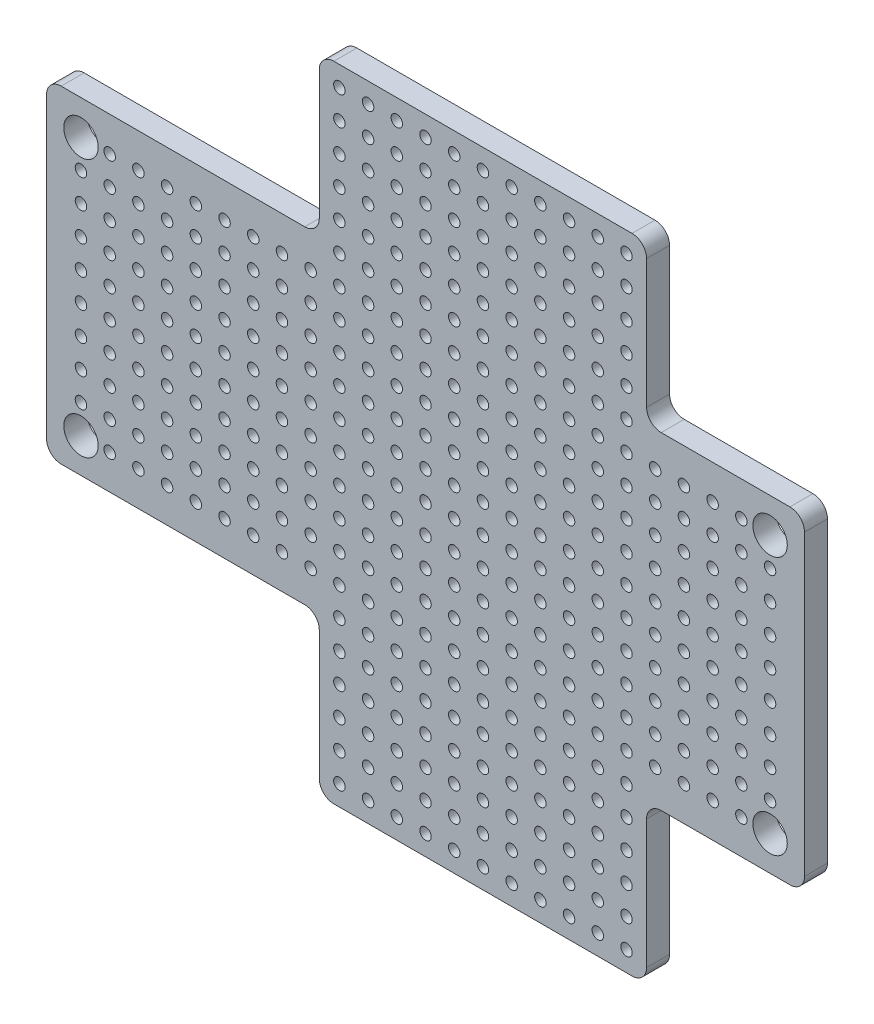
from build123d import *

# Parameters (mm, degrees)
SKETCH1_R           = 1.5
SKETCH1_R_2         = 0.5
BOSS_EXTRUDE1_DEPTH = 2
FILLET1_R           = 1.27


with BuildPart() as part:
    # Sketch1 → Boss-Extrude1 (new body)
    with BuildSketch(Plane.XY):
        Polygon((0, 0), (23.75, 0), (23.75, -13.75), (52.25, -13.75), (52.25, 0), (66, 0), (66, 28.5), (52.25, 28.5), (52.25, 42.25), (23.75, 42.25), (23.75, 28.5), (0, 28.5), align=None)
        with Locations((3, 25.5)):
            Circle(SKETCH1_R, mode=Mode.SUBTRACT)
        with Locations((63, 25.5)):
            Circle(SKETCH1_R, mode=Mode.SUBTRACT)
        with Locations((3, 3)):
            Circle(SKETCH1_R, mode=Mode.SUBTRACT)
        with Locations((63, 3)):
            Circle(SKETCH1_R, mode=Mode.SUBTRACT)
        with Locations((55.5, 5.5)):
            Circle(SKETCH1_R_2, mode=Mode.SUBTRACT)
        with Locations((5.5, 3)):
            Circle(SKETCH1_R_2, mode=Mode.SUBTRACT)
        with Locations((8, 3)):
            Circle(SKETCH1_R_2, mode=Mode.SUBTRACT)
        with Locations((10.5, 3)):
            Circle(SKETCH1_R_2, mode=Mode.SUBTRACT)
        with Locations((13, 3)):
            Circle(SKETCH1_R_2, mode=Mode.SUBTRACT)
        with Locations((15.5, 3)):
            Circle(SKETCH1_R_2, mode=Mode.SUBTRACT)
        with Locations((18, 3)):
            Circle(SKETCH1_R_2, mode=Mode.SUBTRACT)
        with Locations((20.5, 3)):
            Circle(SKETCH1_R_2, mode=Mode.SUBTRACT)
        with Locations((23, 3)):
            Circle(SKETCH1_R_2, mode=Mode.SUBTRACT)
        with Locations((25.5, 3)):
            Circle(SKETCH1_R_2, mode=Mode.SUBTRACT)
        with Locations((28, 3)):
            Circle(SKETCH1_R_2, mode=Mode.SUBTRACT)
        with Locations((30.5, 3)):
            Circle(SKETCH1_R_2, mode=Mode.SUBTRACT)
        with Locations((33, 3)):
            Circle(SKETCH1_R_2, mode=Mode.SUBTRACT)
        with Locations((35.5, 3)):
            Circle(SKETCH1_R_2, mode=Mode.SUBTRACT)
        with Locations((38, 3)):
            Circle(SKETCH1_R_2, mode=Mode.SUBTRACT)
        with Locations((40.5, 3)):
            Circle(SKETCH1_R_2, mode=Mode.SUBTRACT)
        with Locations((43, 3)):
            Circle(SKETCH1_R_2, mode=Mode.SUBTRACT)
        with Locations((45.5, 3)):
            Circle(SKETCH1_R_2, mode=Mode.SUBTRACT)
        with Locations((48, 3)):
            Circle(SKETCH1_R_2, mode=Mode.SUBTRACT)
        with Locations((50.5, 3)):
            Circle(SKETCH1_R_2, mode=Mode.SUBTRACT)
        with Locations((55.5, 10.5)):
            Circle(SKETCH1_R_2, mode=Mode.SUBTRACT)
        with Locations((55.5, 8)):
            Circle(SKETCH1_R_2, mode=Mode.SUBTRACT)
        with Locations((55.5, 15.5)):
            Circle(SKETCH1_R_2, mode=Mode.SUBTRACT)
        with Locations((55.5, 18)):
            Circle(SKETCH1_R_2, mode=Mode.SUBTRACT)
        with Locations((55.5, 20.5)):
            Circle(SKETCH1_R_2, mode=Mode.SUBTRACT)
        with Locations((55.5, 23)):
            Circle(SKETCH1_R_2, mode=Mode.SUBTRACT)
        with Locations((53, 3)):
            Circle(SKETCH1_R_2, mode=Mode.SUBTRACT)
        with Locations((53, 25.5)):
            Circle(SKETCH1_R_2, mode=Mode.SUBTRACT)
        with Locations((58, 5.5)):
            Circle(SKETCH1_R_2, mode=Mode.SUBTRACT)
        with Locations((5.5, 5.5)):
            Circle(SKETCH1_R_2, mode=Mode.SUBTRACT)
        with Locations((8, 5.5)):
            Circle(SKETCH1_R_2, mode=Mode.SUBTRACT)
        with Locations((10.5, 5.5)):
            Circle(SKETCH1_R_2, mode=Mode.SUBTRACT)
        with Locations((13, 5.5)):
            Circle(SKETCH1_R_2, mode=Mode.SUBTRACT)
        with Locations((15.5, 5.5)):
            Circle(SKETCH1_R_2, mode=Mode.SUBTRACT)
        with Locations((18, 5.5)):
            Circle(SKETCH1_R_2, mode=Mode.SUBTRACT)
        with Locations((20.5, 5.5)):
            Circle(SKETCH1_R_2, mode=Mode.SUBTRACT)
        with Locations((23, 5.5)):
            Circle(SKETCH1_R_2, mode=Mode.SUBTRACT)
        with Locations((25.5, 5.5)):
            Circle(SKETCH1_R_2, mode=Mode.SUBTRACT)
        with Locations((28, 5.5)):
            Circle(SKETCH1_R_2, mode=Mode.SUBTRACT)
        with Locations((30.5, 5.5)):
            Circle(SKETCH1_R_2, mode=Mode.SUBTRACT)
        with Locations((33, 5.5)):
            Circle(SKETCH1_R_2, mode=Mode.SUBTRACT)
        with Locations((35.5, 5.5)):
            Circle(SKETCH1_R_2, mode=Mode.SUBTRACT)
        with Locations((38, 5.5)):
            Circle(SKETCH1_R_2, mode=Mode.SUBTRACT)
        with Locations((40.5, 5.5)):
            Circle(SKETCH1_R_2, mode=Mode.SUBTRACT)
        with Locations((43, 5.5)):
            Circle(SKETCH1_R_2, mode=Mode.SUBTRACT)
        with Locations((45.5, 5.5)):
            Circle(SKETCH1_R_2, mode=Mode.SUBTRACT)
        with Locations((48, 5.5)):
            Circle(SKETCH1_R_2, mode=Mode.SUBTRACT)
        with Locations((50.5, 5.5)):
            Circle(SKETCH1_R_2, mode=Mode.SUBTRACT)
        with Locations((53, 5.5)):
            Circle(SKETCH1_R_2, mode=Mode.SUBTRACT)
        with Locations((58, 10.5)):
            Circle(SKETCH1_R_2, mode=Mode.SUBTRACT)
        with Locations((58, 8)):
            Circle(SKETCH1_R_2, mode=Mode.SUBTRACT)
        with Locations((58, 15.5)):
            Circle(SKETCH1_R_2, mode=Mode.SUBTRACT)
        with Locations((58, 18)):
            Circle(SKETCH1_R_2, mode=Mode.SUBTRACT)
        with Locations((58, 20.5)):
            Circle(SKETCH1_R_2, mode=Mode.SUBTRACT)
        with Locations((58, 23)):
            Circle(SKETCH1_R_2, mode=Mode.SUBTRACT)
        with Locations((55.5, 3)):
            Circle(SKETCH1_R_2, mode=Mode.SUBTRACT)
        with Locations((55.5, 25.5)):
            Circle(SKETCH1_R_2, mode=Mode.SUBTRACT)
        with Locations((5.5, 8)):
            Circle(SKETCH1_R_2, mode=Mode.SUBTRACT)
        with Locations((8, 8)):
            Circle(SKETCH1_R_2, mode=Mode.SUBTRACT)
        with Locations((10.5, 8)):
            Circle(SKETCH1_R_2, mode=Mode.SUBTRACT)
        with Locations((13, 8)):
            Circle(SKETCH1_R_2, mode=Mode.SUBTRACT)
        with Locations((15.5, 8)):
            Circle(SKETCH1_R_2, mode=Mode.SUBTRACT)
        with Locations((18, 8)):
            Circle(SKETCH1_R_2, mode=Mode.SUBTRACT)
        with Locations((20.5, 8)):
            Circle(SKETCH1_R_2, mode=Mode.SUBTRACT)
        with Locations((23, 8)):
            Circle(SKETCH1_R_2, mode=Mode.SUBTRACT)
        with Locations((25.5, 8)):
            Circle(SKETCH1_R_2, mode=Mode.SUBTRACT)
        with Locations((28, 8)):
            Circle(SKETCH1_R_2, mode=Mode.SUBTRACT)
        with Locations((30.5, 8)):
            Circle(SKETCH1_R_2, mode=Mode.SUBTRACT)
        with Locations((33, 8)):
            Circle(SKETCH1_R_2, mode=Mode.SUBTRACT)
        with Locations((35.5, 8)):
            Circle(SKETCH1_R_2, mode=Mode.SUBTRACT)
        with Locations((38, 8)):
            Circle(SKETCH1_R_2, mode=Mode.SUBTRACT)
        with Locations((40.5, 8)):
            Circle(SKETCH1_R_2, mode=Mode.SUBTRACT)
        with Locations((43, 8)):
            Circle(SKETCH1_R_2, mode=Mode.SUBTRACT)
        with Locations((45.5, 8)):
            Circle(SKETCH1_R_2, mode=Mode.SUBTRACT)
        with Locations((48, 8)):
            Circle(SKETCH1_R_2, mode=Mode.SUBTRACT)
        with Locations((50.5, 8)):
            Circle(SKETCH1_R_2, mode=Mode.SUBTRACT)
        with Locations((53, 8)):
            Circle(SKETCH1_R_2, mode=Mode.SUBTRACT)
        with Locations((60.5, 5.5)):
            Circle(SKETCH1_R_2, mode=Mode.SUBTRACT)
        with Locations((60.5, 10.5)):
            Circle(SKETCH1_R_2, mode=Mode.SUBTRACT)
        with Locations((60.5, 8)):
            Circle(SKETCH1_R_2, mode=Mode.SUBTRACT)
        with Locations((60.5, 15.5)):
            Circle(SKETCH1_R_2, mode=Mode.SUBTRACT)
        with Locations((60.5, 18)):
            Circle(SKETCH1_R_2, mode=Mode.SUBTRACT)
        with Locations((60.5, 20.5)):
            Circle(SKETCH1_R_2, mode=Mode.SUBTRACT)
        with Locations((60.5, 23)):
            Circle(SKETCH1_R_2, mode=Mode.SUBTRACT)
        with Locations((58, 3)):
            Circle(SKETCH1_R_2, mode=Mode.SUBTRACT)
        with Locations((5.5, 10.5)):
            Circle(SKETCH1_R_2, mode=Mode.SUBTRACT)
        with Locations((8, 10.5)):
            Circle(SKETCH1_R_2, mode=Mode.SUBTRACT)
        with Locations((10.5, 10.5)):
            Circle(SKETCH1_R_2, mode=Mode.SUBTRACT)
        with Locations((13, 10.5)):
            Circle(SKETCH1_R_2, mode=Mode.SUBTRACT)
        with Locations((15.5, 10.5)):
            Circle(SKETCH1_R_2, mode=Mode.SUBTRACT)
        with Locations((18, 10.5)):
            Circle(SKETCH1_R_2, mode=Mode.SUBTRACT)
        with Locations((20.5, 10.5)):
            Circle(SKETCH1_R_2, mode=Mode.SUBTRACT)
        with Locations((23, 10.5)):
            Circle(SKETCH1_R_2, mode=Mode.SUBTRACT)
        with Locations((25.5, 10.5)):
            Circle(SKETCH1_R_2, mode=Mode.SUBTRACT)
        with Locations((28, 10.5)):
            Circle(SKETCH1_R_2, mode=Mode.SUBTRACT)
        with Locations((30.5, 10.5)):
            Circle(SKETCH1_R_2, mode=Mode.SUBTRACT)
        with Locations((33, 10.5)):
            Circle(SKETCH1_R_2, mode=Mode.SUBTRACT)
        with Locations((35.5, 10.5)):
            Circle(SKETCH1_R_2, mode=Mode.SUBTRACT)
        with Locations((38, 10.5)):
            Circle(SKETCH1_R_2, mode=Mode.SUBTRACT)
        with Locations((40.5, 10.5)):
            Circle(SKETCH1_R_2, mode=Mode.SUBTRACT)
        with Locations((43, 10.5)):
            Circle(SKETCH1_R_2, mode=Mode.SUBTRACT)
        with Locations((45.5, 10.5)):
            Circle(SKETCH1_R_2, mode=Mode.SUBTRACT)
        with Locations((48, 10.5)):
            Circle(SKETCH1_R_2, mode=Mode.SUBTRACT)
        with Locations((50.5, 10.5)):
            Circle(SKETCH1_R_2, mode=Mode.SUBTRACT)
        with Locations((53, 10.5)):
            Circle(SKETCH1_R_2, mode=Mode.SUBTRACT)
        with Locations((58, 25.5)):
            Circle(SKETCH1_R_2, mode=Mode.SUBTRACT)
        with Locations((63, 5.5)):
            Circle(SKETCH1_R_2, mode=Mode.SUBTRACT)
        with Locations((63, 10.5)):
            Circle(SKETCH1_R_2, mode=Mode.SUBTRACT)
        with Locations((63, 8)):
            Circle(SKETCH1_R_2, mode=Mode.SUBTRACT)
        with Locations((63, 15.5)):
            Circle(SKETCH1_R_2, mode=Mode.SUBTRACT)
        with Locations((63, 18)):
            Circle(SKETCH1_R_2, mode=Mode.SUBTRACT)
        with Locations((63, 20.5)):
            Circle(SKETCH1_R_2, mode=Mode.SUBTRACT)
        with Locations((63, 23)):
            Circle(SKETCH1_R_2, mode=Mode.SUBTRACT)
        with Locations((5.5, 13)):
            Circle(SKETCH1_R_2, mode=Mode.SUBTRACT)
        with Locations((8, 13)):
            Circle(SKETCH1_R_2, mode=Mode.SUBTRACT)
        with Locations((10.5, 13)):
            Circle(SKETCH1_R_2, mode=Mode.SUBTRACT)
        with Locations((13, 13)):
            Circle(SKETCH1_R_2, mode=Mode.SUBTRACT)
        with Locations((15.5, 13)):
            Circle(SKETCH1_R_2, mode=Mode.SUBTRACT)
        with Locations((18, 13)):
            Circle(SKETCH1_R_2, mode=Mode.SUBTRACT)
        with Locations((20.5, 13)):
            Circle(SKETCH1_R_2, mode=Mode.SUBTRACT)
        with Locations((23, 13)):
            Circle(SKETCH1_R_2, mode=Mode.SUBTRACT)
        with Locations((25.5, 13)):
            Circle(SKETCH1_R_2, mode=Mode.SUBTRACT)
        with Locations((28, 13)):
            Circle(SKETCH1_R_2, mode=Mode.SUBTRACT)
        with Locations((30.5, 13)):
            Circle(SKETCH1_R_2, mode=Mode.SUBTRACT)
        with Locations((33, 13)):
            Circle(SKETCH1_R_2, mode=Mode.SUBTRACT)
        with Locations((35.5, 13)):
            Circle(SKETCH1_R_2, mode=Mode.SUBTRACT)
        with Locations((38, 13)):
            Circle(SKETCH1_R_2, mode=Mode.SUBTRACT)
        with Locations((40.5, 13)):
            Circle(SKETCH1_R_2, mode=Mode.SUBTRACT)
        with Locations((43, 13)):
            Circle(SKETCH1_R_2, mode=Mode.SUBTRACT)
        with Locations((45.5, 13)):
            Circle(SKETCH1_R_2, mode=Mode.SUBTRACT)
        with Locations((48, 13)):
            Circle(SKETCH1_R_2, mode=Mode.SUBTRACT)
        with Locations((50.5, 13)):
            Circle(SKETCH1_R_2, mode=Mode.SUBTRACT)
        with Locations((53, 13)):
            Circle(SKETCH1_R_2, mode=Mode.SUBTRACT)
        with Locations((60.5, 3)):
            Circle(SKETCH1_R_2, mode=Mode.SUBTRACT)
        with Locations((60.5, 25.5)):
            Circle(SKETCH1_R_2, mode=Mode.SUBTRACT)
        with Locations((55.5, 13)):
            Circle(SKETCH1_R_2, mode=Mode.SUBTRACT)
        with Locations((58, 13)):
            Circle(SKETCH1_R_2, mode=Mode.SUBTRACT)
        with Locations((60.5, 13)):
            Circle(SKETCH1_R_2, mode=Mode.SUBTRACT)
        with Locations((63, 13)):
            Circle(SKETCH1_R_2, mode=Mode.SUBTRACT)
        with Locations((5.5, 15.5)):
            Circle(SKETCH1_R_2, mode=Mode.SUBTRACT)
        with Locations((8, 15.5)):
            Circle(SKETCH1_R_2, mode=Mode.SUBTRACT)
        with Locations((10.5, 15.5)):
            Circle(SKETCH1_R_2, mode=Mode.SUBTRACT)
        with Locations((13, 15.5)):
            Circle(SKETCH1_R_2, mode=Mode.SUBTRACT)
        with Locations((15.5, 15.5)):
            Circle(SKETCH1_R_2, mode=Mode.SUBTRACT)
        with Locations((18, 15.5)):
            Circle(SKETCH1_R_2, mode=Mode.SUBTRACT)
        with Locations((20.5, 15.5)):
            Circle(SKETCH1_R_2, mode=Mode.SUBTRACT)
        with Locations((23, 15.5)):
            Circle(SKETCH1_R_2, mode=Mode.SUBTRACT)
        with Locations((25.5, 15.5)):
            Circle(SKETCH1_R_2, mode=Mode.SUBTRACT)
        with Locations((28, 15.5)):
            Circle(SKETCH1_R_2, mode=Mode.SUBTRACT)
        with Locations((30.5, 15.5)):
            Circle(SKETCH1_R_2, mode=Mode.SUBTRACT)
        with Locations((33, 15.5)):
            Circle(SKETCH1_R_2, mode=Mode.SUBTRACT)
        with Locations((35.5, 15.5)):
            Circle(SKETCH1_R_2, mode=Mode.SUBTRACT)
        with Locations((38, 15.5)):
            Circle(SKETCH1_R_2, mode=Mode.SUBTRACT)
        with Locations((40.5, 15.5)):
            Circle(SKETCH1_R_2, mode=Mode.SUBTRACT)
        with Locations((43, 15.5)):
            Circle(SKETCH1_R_2, mode=Mode.SUBTRACT)
        with Locations((45.5, 15.5)):
            Circle(SKETCH1_R_2, mode=Mode.SUBTRACT)
        with Locations((48, 15.5)):
            Circle(SKETCH1_R_2, mode=Mode.SUBTRACT)
        with Locations((50.5, 15.5)):
            Circle(SKETCH1_R_2, mode=Mode.SUBTRACT)
        with Locations((53, 15.5)):
            Circle(SKETCH1_R_2, mode=Mode.SUBTRACT)
        with Locations((5.5, 18)):
            Circle(SKETCH1_R_2, mode=Mode.SUBTRACT)
        with Locations((8, 18)):
            Circle(SKETCH1_R_2, mode=Mode.SUBTRACT)
        with Locations((10.5, 18)):
            Circle(SKETCH1_R_2, mode=Mode.SUBTRACT)
        with Locations((13, 18)):
            Circle(SKETCH1_R_2, mode=Mode.SUBTRACT)
        with Locations((15.5, 18)):
            Circle(SKETCH1_R_2, mode=Mode.SUBTRACT)
        with Locations((18, 18)):
            Circle(SKETCH1_R_2, mode=Mode.SUBTRACT)
        with Locations((20.5, 18)):
            Circle(SKETCH1_R_2, mode=Mode.SUBTRACT)
        with Locations((23, 18)):
            Circle(SKETCH1_R_2, mode=Mode.SUBTRACT)
        with Locations((25.5, 18)):
            Circle(SKETCH1_R_2, mode=Mode.SUBTRACT)
        with Locations((28, 18)):
            Circle(SKETCH1_R_2, mode=Mode.SUBTRACT)
        with Locations((30.5, 18)):
            Circle(SKETCH1_R_2, mode=Mode.SUBTRACT)
        with Locations((33, 18)):
            Circle(SKETCH1_R_2, mode=Mode.SUBTRACT)
        with Locations((35.5, 18)):
            Circle(SKETCH1_R_2, mode=Mode.SUBTRACT)
        with Locations((38, 18)):
            Circle(SKETCH1_R_2, mode=Mode.SUBTRACT)
        with Locations((40.5, 18)):
            Circle(SKETCH1_R_2, mode=Mode.SUBTRACT)
        with Locations((43, 18)):
            Circle(SKETCH1_R_2, mode=Mode.SUBTRACT)
        with Locations((45.5, 18)):
            Circle(SKETCH1_R_2, mode=Mode.SUBTRACT)
        with Locations((48, 18)):
            Circle(SKETCH1_R_2, mode=Mode.SUBTRACT)
        with Locations((50.5, 18)):
            Circle(SKETCH1_R_2, mode=Mode.SUBTRACT)
        with Locations((53, 18)):
            Circle(SKETCH1_R_2, mode=Mode.SUBTRACT)
        with Locations((5.5, 20.5)):
            Circle(SKETCH1_R_2, mode=Mode.SUBTRACT)
        with Locations((8, 20.5)):
            Circle(SKETCH1_R_2, mode=Mode.SUBTRACT)
        with Locations((10.5, 20.5)):
            Circle(SKETCH1_R_2, mode=Mode.SUBTRACT)
        with Locations((13, 20.5)):
            Circle(SKETCH1_R_2, mode=Mode.SUBTRACT)
        with Locations((15.5, 20.5)):
            Circle(SKETCH1_R_2, mode=Mode.SUBTRACT)
        with Locations((18, 20.5)):
            Circle(SKETCH1_R_2, mode=Mode.SUBTRACT)
        with Locations((20.5, 20.5)):
            Circle(SKETCH1_R_2, mode=Mode.SUBTRACT)
        with Locations((23, 20.5)):
            Circle(SKETCH1_R_2, mode=Mode.SUBTRACT)
        with Locations((25.5, 20.5)):
            Circle(SKETCH1_R_2, mode=Mode.SUBTRACT)
        with Locations((28, 20.5)):
            Circle(SKETCH1_R_2, mode=Mode.SUBTRACT)
        with Locations((30.5, 20.5)):
            Circle(SKETCH1_R_2, mode=Mode.SUBTRACT)
        with Locations((33, 20.5)):
            Circle(SKETCH1_R_2, mode=Mode.SUBTRACT)
        with Locations((35.5, 20.5)):
            Circle(SKETCH1_R_2, mode=Mode.SUBTRACT)
        with Locations((38, 20.5)):
            Circle(SKETCH1_R_2, mode=Mode.SUBTRACT)
        with Locations((40.5, 20.5)):
            Circle(SKETCH1_R_2, mode=Mode.SUBTRACT)
        with Locations((43, 20.5)):
            Circle(SKETCH1_R_2, mode=Mode.SUBTRACT)
        with Locations((45.5, 20.5)):
            Circle(SKETCH1_R_2, mode=Mode.SUBTRACT)
        with Locations((48, 20.5)):
            Circle(SKETCH1_R_2, mode=Mode.SUBTRACT)
        with Locations((50.5, 20.5)):
            Circle(SKETCH1_R_2, mode=Mode.SUBTRACT)
        with Locations((53, 20.5)):
            Circle(SKETCH1_R_2, mode=Mode.SUBTRACT)
        with Locations((5.5, 23)):
            Circle(SKETCH1_R_2, mode=Mode.SUBTRACT)
        with Locations((8, 23)):
            Circle(SKETCH1_R_2, mode=Mode.SUBTRACT)
        with Locations((10.5, 23)):
            Circle(SKETCH1_R_2, mode=Mode.SUBTRACT)
        with Locations((13, 23)):
            Circle(SKETCH1_R_2, mode=Mode.SUBTRACT)
        with Locations((15.5, 23)):
            Circle(SKETCH1_R_2, mode=Mode.SUBTRACT)
        with Locations((18, 23)):
            Circle(SKETCH1_R_2, mode=Mode.SUBTRACT)
        with Locations((20.5, 23)):
            Circle(SKETCH1_R_2, mode=Mode.SUBTRACT)
        with Locations((23, 23)):
            Circle(SKETCH1_R_2, mode=Mode.SUBTRACT)
        with Locations((25.5, 23)):
            Circle(SKETCH1_R_2, mode=Mode.SUBTRACT)
        with Locations((28, 23)):
            Circle(SKETCH1_R_2, mode=Mode.SUBTRACT)
        with Locations((30.5, 23)):
            Circle(SKETCH1_R_2, mode=Mode.SUBTRACT)
        with Locations((33, 23)):
            Circle(SKETCH1_R_2, mode=Mode.SUBTRACT)
        with Locations((35.5, 23)):
            Circle(SKETCH1_R_2, mode=Mode.SUBTRACT)
        with Locations((38, 23)):
            Circle(SKETCH1_R_2, mode=Mode.SUBTRACT)
        with Locations((40.5, 23)):
            Circle(SKETCH1_R_2, mode=Mode.SUBTRACT)
        with Locations((43, 23)):
            Circle(SKETCH1_R_2, mode=Mode.SUBTRACT)
        with Locations((45.5, 23)):
            Circle(SKETCH1_R_2, mode=Mode.SUBTRACT)
        with Locations((48, 23)):
            Circle(SKETCH1_R_2, mode=Mode.SUBTRACT)
        with Locations((50.5, 23)):
            Circle(SKETCH1_R_2, mode=Mode.SUBTRACT)
        with Locations((53, 23)):
            Circle(SKETCH1_R_2, mode=Mode.SUBTRACT)
        with Locations((5.5, 25.5)):
            Circle(SKETCH1_R_2, mode=Mode.SUBTRACT)
        with Locations((8, 25.5)):
            Circle(SKETCH1_R_2, mode=Mode.SUBTRACT)
        with Locations((10.5, 25.5)):
            Circle(SKETCH1_R_2, mode=Mode.SUBTRACT)
        with Locations((13, 25.5)):
            Circle(SKETCH1_R_2, mode=Mode.SUBTRACT)
        with Locations((15.5, 25.5)):
            Circle(SKETCH1_R_2, mode=Mode.SUBTRACT)
        with Locations((18, 25.5)):
            Circle(SKETCH1_R_2, mode=Mode.SUBTRACT)
        with Locations((20.5, 25.5)):
            Circle(SKETCH1_R_2, mode=Mode.SUBTRACT)
        with Locations((23, 25.5)):
            Circle(SKETCH1_R_2, mode=Mode.SUBTRACT)
        with Locations((25.5, 25.5)):
            Circle(SKETCH1_R_2, mode=Mode.SUBTRACT)
        with Locations((28, 25.5)):
            Circle(SKETCH1_R_2, mode=Mode.SUBTRACT)
        with Locations((30.5, 25.5)):
            Circle(SKETCH1_R_2, mode=Mode.SUBTRACT)
        with Locations((33, 25.5)):
            Circle(SKETCH1_R_2, mode=Mode.SUBTRACT)
        with Locations((35.5, 25.5)):
            Circle(SKETCH1_R_2, mode=Mode.SUBTRACT)
        with Locations((38, 25.5)):
            Circle(SKETCH1_R_2, mode=Mode.SUBTRACT)
        with Locations((40.5, 25.5)):
            Circle(SKETCH1_R_2, mode=Mode.SUBTRACT)
        with Locations((43, 25.5)):
            Circle(SKETCH1_R_2, mode=Mode.SUBTRACT)
        with Locations((45.5, 25.5)):
            Circle(SKETCH1_R_2, mode=Mode.SUBTRACT)
        with Locations((48, 25.5)):
            Circle(SKETCH1_R_2, mode=Mode.SUBTRACT)
        with Locations((50.5, 25.5)):
            Circle(SKETCH1_R_2, mode=Mode.SUBTRACT)
        with Locations((3, 5.5)):
            Circle(SKETCH1_R_2, mode=Mode.SUBTRACT)
        with Locations((3, 8)):
            Circle(SKETCH1_R_2, mode=Mode.SUBTRACT)
        with Locations((3, 10.5)):
            Circle(SKETCH1_R_2, mode=Mode.SUBTRACT)
        with Locations((3, 13)):
            Circle(SKETCH1_R_2, mode=Mode.SUBTRACT)
        with Locations((3, 15.5)):
            Circle(SKETCH1_R_2, mode=Mode.SUBTRACT)
        with Locations((3, 18)):
            Circle(SKETCH1_R_2, mode=Mode.SUBTRACT)
        with Locations((3, 20.5)):
            Circle(SKETCH1_R_2, mode=Mode.SUBTRACT)
        with Locations((3, 23)):
            Circle(SKETCH1_R_2, mode=Mode.SUBTRACT)
        with Locations((25.5, 28)):
            Circle(SKETCH1_R_2, mode=Mode.SUBTRACT)
        with Locations((28, 28)):
            Circle(SKETCH1_R_2, mode=Mode.SUBTRACT)
        with Locations((30.5, 28)):
            Circle(SKETCH1_R_2, mode=Mode.SUBTRACT)
        with Locations((33, 28)):
            Circle(SKETCH1_R_2, mode=Mode.SUBTRACT)
        with Locations((35.5, 28)):
            Circle(SKETCH1_R_2, mode=Mode.SUBTRACT)
        with Locations((38, 28)):
            Circle(SKETCH1_R_2, mode=Mode.SUBTRACT)
        with Locations((40.5, 28)):
            Circle(SKETCH1_R_2, mode=Mode.SUBTRACT)
        with Locations((43, 28)):
            Circle(SKETCH1_R_2, mode=Mode.SUBTRACT)
        with Locations((45.5, 28)):
            Circle(SKETCH1_R_2, mode=Mode.SUBTRACT)
        with Locations((48, 28)):
            Circle(SKETCH1_R_2, mode=Mode.SUBTRACT)
        with Locations((50.5, 28)):
            Circle(SKETCH1_R_2, mode=Mode.SUBTRACT)
        with Locations((25.5, 30.5)):
            Circle(SKETCH1_R_2, mode=Mode.SUBTRACT)
        with Locations((28, 30.5)):
            Circle(SKETCH1_R_2, mode=Mode.SUBTRACT)
        with Locations((30.5, 30.5)):
            Circle(SKETCH1_R_2, mode=Mode.SUBTRACT)
        with Locations((33, 30.5)):
            Circle(SKETCH1_R_2, mode=Mode.SUBTRACT)
        with Locations((35.5, 30.5)):
            Circle(SKETCH1_R_2, mode=Mode.SUBTRACT)
        with Locations((38, 30.5)):
            Circle(SKETCH1_R_2, mode=Mode.SUBTRACT)
        with Locations((40.5, 30.5)):
            Circle(SKETCH1_R_2, mode=Mode.SUBTRACT)
        with Locations((43, 30.5)):
            Circle(SKETCH1_R_2, mode=Mode.SUBTRACT)
        with Locations((45.5, 30.5)):
            Circle(SKETCH1_R_2, mode=Mode.SUBTRACT)
        with Locations((48, 30.5)):
            Circle(SKETCH1_R_2, mode=Mode.SUBTRACT)
        with Locations((50.5, 30.5)):
            Circle(SKETCH1_R_2, mode=Mode.SUBTRACT)
        with Locations((25.5, 33)):
            Circle(SKETCH1_R_2, mode=Mode.SUBTRACT)
        with Locations((28, 33)):
            Circle(SKETCH1_R_2, mode=Mode.SUBTRACT)
        with Locations((30.5, 33)):
            Circle(SKETCH1_R_2, mode=Mode.SUBTRACT)
        with Locations((33, 33)):
            Circle(SKETCH1_R_2, mode=Mode.SUBTRACT)
        with Locations((35.5, 33)):
            Circle(SKETCH1_R_2, mode=Mode.SUBTRACT)
        with Locations((38, 33)):
            Circle(SKETCH1_R_2, mode=Mode.SUBTRACT)
        with Locations((40.5, 33)):
            Circle(SKETCH1_R_2, mode=Mode.SUBTRACT)
        with Locations((43, 33)):
            Circle(SKETCH1_R_2, mode=Mode.SUBTRACT)
        with Locations((45.5, 33)):
            Circle(SKETCH1_R_2, mode=Mode.SUBTRACT)
        with Locations((48, 33)):
            Circle(SKETCH1_R_2, mode=Mode.SUBTRACT)
        with Locations((50.5, 33)):
            Circle(SKETCH1_R_2, mode=Mode.SUBTRACT)
        with Locations((25.5, 35.5)):
            Circle(SKETCH1_R_2, mode=Mode.SUBTRACT)
        with Locations((28, 35.5)):
            Circle(SKETCH1_R_2, mode=Mode.SUBTRACT)
        with Locations((30.5, 35.5)):
            Circle(SKETCH1_R_2, mode=Mode.SUBTRACT)
        with Locations((33, 35.5)):
            Circle(SKETCH1_R_2, mode=Mode.SUBTRACT)
        with Locations((35.5, 35.5)):
            Circle(SKETCH1_R_2, mode=Mode.SUBTRACT)
        with Locations((38, 35.5)):
            Circle(SKETCH1_R_2, mode=Mode.SUBTRACT)
        with Locations((40.5, 35.5)):
            Circle(SKETCH1_R_2, mode=Mode.SUBTRACT)
        with Locations((43, 35.5)):
            Circle(SKETCH1_R_2, mode=Mode.SUBTRACT)
        with Locations((45.5, 35.5)):
            Circle(SKETCH1_R_2, mode=Mode.SUBTRACT)
        with Locations((48, 35.5)):
            Circle(SKETCH1_R_2, mode=Mode.SUBTRACT)
        with Locations((50.5, 35.5)):
            Circle(SKETCH1_R_2, mode=Mode.SUBTRACT)
        with Locations((25.5, 38)):
            Circle(SKETCH1_R_2, mode=Mode.SUBTRACT)
        with Locations((28, 38)):
            Circle(SKETCH1_R_2, mode=Mode.SUBTRACT)
        with Locations((30.5, 38)):
            Circle(SKETCH1_R_2, mode=Mode.SUBTRACT)
        with Locations((33, 38)):
            Circle(SKETCH1_R_2, mode=Mode.SUBTRACT)
        with Locations((35.5, 38)):
            Circle(SKETCH1_R_2, mode=Mode.SUBTRACT)
        with Locations((38, 38)):
            Circle(SKETCH1_R_2, mode=Mode.SUBTRACT)
        with Locations((40.5, 38)):
            Circle(SKETCH1_R_2, mode=Mode.SUBTRACT)
        with Locations((43, 38)):
            Circle(SKETCH1_R_2, mode=Mode.SUBTRACT)
        with Locations((45.5, 38)):
            Circle(SKETCH1_R_2, mode=Mode.SUBTRACT)
        with Locations((48, 38)):
            Circle(SKETCH1_R_2, mode=Mode.SUBTRACT)
        with Locations((50.5, 38)):
            Circle(SKETCH1_R_2, mode=Mode.SUBTRACT)
        with Locations((25.5, 40.5)):
            Circle(SKETCH1_R_2, mode=Mode.SUBTRACT)
        with Locations((28, 40.5)):
            Circle(SKETCH1_R_2, mode=Mode.SUBTRACT)
        with Locations((30.5, 40.5)):
            Circle(SKETCH1_R_2, mode=Mode.SUBTRACT)
        with Locations((33, 40.5)):
            Circle(SKETCH1_R_2, mode=Mode.SUBTRACT)
        with Locations((35.5, 40.5)):
            Circle(SKETCH1_R_2, mode=Mode.SUBTRACT)
        with Locations((38, 40.5)):
            Circle(SKETCH1_R_2, mode=Mode.SUBTRACT)
        with Locations((40.5, 40.5)):
            Circle(SKETCH1_R_2, mode=Mode.SUBTRACT)
        with Locations((43, 40.5)):
            Circle(SKETCH1_R_2, mode=Mode.SUBTRACT)
        with Locations((45.5, 40.5)):
            Circle(SKETCH1_R_2, mode=Mode.SUBTRACT)
        with Locations((48, 40.5)):
            Circle(SKETCH1_R_2, mode=Mode.SUBTRACT)
        with Locations((50.5, 40.5)):
            Circle(SKETCH1_R_2, mode=Mode.SUBTRACT)
        with Locations((25.5, -12)):
            Circle(SKETCH1_R_2, mode=Mode.SUBTRACT)
        with Locations((25.5, -9.5)):
            Circle(SKETCH1_R_2, mode=Mode.SUBTRACT)
        with Locations((25.5, -7)):
            Circle(SKETCH1_R_2, mode=Mode.SUBTRACT)
        with Locations((25.5, -4.5)):
            Circle(SKETCH1_R_2, mode=Mode.SUBTRACT)
        with Locations((25.5, -2)):
            Circle(SKETCH1_R_2, mode=Mode.SUBTRACT)
        with Locations((25.5, 0.5)):
            Circle(SKETCH1_R_2, mode=Mode.SUBTRACT)
        with Locations((50.5, -12)):
            Circle(SKETCH1_R_2, mode=Mode.SUBTRACT)
        with Locations((48, -12)):
            Circle(SKETCH1_R_2, mode=Mode.SUBTRACT)
        with Locations((45.5, -12)):
            Circle(SKETCH1_R_2, mode=Mode.SUBTRACT)
        with Locations((43, -12)):
            Circle(SKETCH1_R_2, mode=Mode.SUBTRACT)
        with Locations((40.5, -12)):
            Circle(SKETCH1_R_2, mode=Mode.SUBTRACT)
        with Locations((38, -12)):
            Circle(SKETCH1_R_2, mode=Mode.SUBTRACT)
        with Locations((35.5, -12)):
            Circle(SKETCH1_R_2, mode=Mode.SUBTRACT)
        with Locations((33, -12)):
            Circle(SKETCH1_R_2, mode=Mode.SUBTRACT)
        with Locations((30.5, -12)):
            Circle(SKETCH1_R_2, mode=Mode.SUBTRACT)
        with Locations((28, -12)):
            Circle(SKETCH1_R_2, mode=Mode.SUBTRACT)
        with Locations((50.5, -9.5)):
            Circle(SKETCH1_R_2, mode=Mode.SUBTRACT)
        with Locations((48, -9.5)):
            Circle(SKETCH1_R_2, mode=Mode.SUBTRACT)
        with Locations((45.5, -9.5)):
            Circle(SKETCH1_R_2, mode=Mode.SUBTRACT)
        with Locations((43, -9.5)):
            Circle(SKETCH1_R_2, mode=Mode.SUBTRACT)
        with Locations((40.5, -9.5)):
            Circle(SKETCH1_R_2, mode=Mode.SUBTRACT)
        with Locations((38, -9.5)):
            Circle(SKETCH1_R_2, mode=Mode.SUBTRACT)
        with Locations((35.5, -9.5)):
            Circle(SKETCH1_R_2, mode=Mode.SUBTRACT)
        with Locations((33, -9.5)):
            Circle(SKETCH1_R_2, mode=Mode.SUBTRACT)
        with Locations((30.5, -9.5)):
            Circle(SKETCH1_R_2, mode=Mode.SUBTRACT)
        with Locations((28, -9.5)):
            Circle(SKETCH1_R_2, mode=Mode.SUBTRACT)
        with Locations((50.5, -7)):
            Circle(SKETCH1_R_2, mode=Mode.SUBTRACT)
        with Locations((48, -7)):
            Circle(SKETCH1_R_2, mode=Mode.SUBTRACT)
        with Locations((45.5, -7)):
            Circle(SKETCH1_R_2, mode=Mode.SUBTRACT)
        with Locations((43, -7)):
            Circle(SKETCH1_R_2, mode=Mode.SUBTRACT)
        with Locations((40.5, -7)):
            Circle(SKETCH1_R_2, mode=Mode.SUBTRACT)
        with Locations((38, -7)):
            Circle(SKETCH1_R_2, mode=Mode.SUBTRACT)
        with Locations((35.5, -7)):
            Circle(SKETCH1_R_2, mode=Mode.SUBTRACT)
        with Locations((33, -7)):
            Circle(SKETCH1_R_2, mode=Mode.SUBTRACT)
        with Locations((30.5, -7)):
            Circle(SKETCH1_R_2, mode=Mode.SUBTRACT)
        with Locations((28, -7)):
            Circle(SKETCH1_R_2, mode=Mode.SUBTRACT)
        with Locations((50.5, -4.5)):
            Circle(SKETCH1_R_2, mode=Mode.SUBTRACT)
        with Locations((48, -4.5)):
            Circle(SKETCH1_R_2, mode=Mode.SUBTRACT)
        with Locations((45.5, -4.5)):
            Circle(SKETCH1_R_2, mode=Mode.SUBTRACT)
        with Locations((43, -4.5)):
            Circle(SKETCH1_R_2, mode=Mode.SUBTRACT)
        with Locations((40.5, -4.5)):
            Circle(SKETCH1_R_2, mode=Mode.SUBTRACT)
        with Locations((38, -4.5)):
            Circle(SKETCH1_R_2, mode=Mode.SUBTRACT)
        with Locations((35.5, -4.5)):
            Circle(SKETCH1_R_2, mode=Mode.SUBTRACT)
        with Locations((33, -4.5)):
            Circle(SKETCH1_R_2, mode=Mode.SUBTRACT)
        with Locations((30.5, -4.5)):
            Circle(SKETCH1_R_2, mode=Mode.SUBTRACT)
        with Locations((28, -4.5)):
            Circle(SKETCH1_R_2, mode=Mode.SUBTRACT)
        with Locations((50.5, -2)):
            Circle(SKETCH1_R_2, mode=Mode.SUBTRACT)
        with Locations((48, -2)):
            Circle(SKETCH1_R_2, mode=Mode.SUBTRACT)
        with Locations((45.5, -2)):
            Circle(SKETCH1_R_2, mode=Mode.SUBTRACT)
        with Locations((43, -2)):
            Circle(SKETCH1_R_2, mode=Mode.SUBTRACT)
        with Locations((40.5, -2)):
            Circle(SKETCH1_R_2, mode=Mode.SUBTRACT)
        with Locations((38, -2)):
            Circle(SKETCH1_R_2, mode=Mode.SUBTRACT)
        with Locations((35.5, -2)):
            Circle(SKETCH1_R_2, mode=Mode.SUBTRACT)
        with Locations((33, -2)):
            Circle(SKETCH1_R_2, mode=Mode.SUBTRACT)
        with Locations((30.5, -2)):
            Circle(SKETCH1_R_2, mode=Mode.SUBTRACT)
        with Locations((28, -2)):
            Circle(SKETCH1_R_2, mode=Mode.SUBTRACT)
        with Locations((50.5, 0.5)):
            Circle(SKETCH1_R_2, mode=Mode.SUBTRACT)
        with Locations((48, 0.5)):
            Circle(SKETCH1_R_2, mode=Mode.SUBTRACT)
        with Locations((45.5, 0.5)):
            Circle(SKETCH1_R_2, mode=Mode.SUBTRACT)
        with Locations((43, 0.5)):
            Circle(SKETCH1_R_2, mode=Mode.SUBTRACT)
        with Locations((40.5, 0.5)):
            Circle(SKETCH1_R_2, mode=Mode.SUBTRACT)
        with Locations((38, 0.5)):
            Circle(SKETCH1_R_2, mode=Mode.SUBTRACT)
        with Locations((35.5, 0.5)):
            Circle(SKETCH1_R_2, mode=Mode.SUBTRACT)
        with Locations((33, 0.5)):
            Circle(SKETCH1_R_2, mode=Mode.SUBTRACT)
        with Locations((30.5, 0.5)):
            Circle(SKETCH1_R_2, mode=Mode.SUBTRACT)
        with Locations((28, 0.5)):
            Circle(SKETCH1_R_2, mode=Mode.SUBTRACT)
    extrude(amount=BOSS_EXTRUDE1_DEPTH)

    # Fillet1
    fillet1_edges = [part.edges().sort_by_distance(p)[0] for p in [
        (0, 28.5, 1),
        (0, 0, 1),
        (52.25, 42.25, 1),
        (23.75, 42.25, 1),
        (23.75, 28.5, 1),
        (23.75, 0, 1),
        (23.75, -13.75, 1),
        (52.25, -13.75, 1),
        (52.25, 28.5, 1),
        (52.25, 0, 1),
        (66, 28.5, 1),
        (66, 0, 1),
    ]]
    fillet(fillet1_edges, radius=FILLET1_R)


solid = part.part
